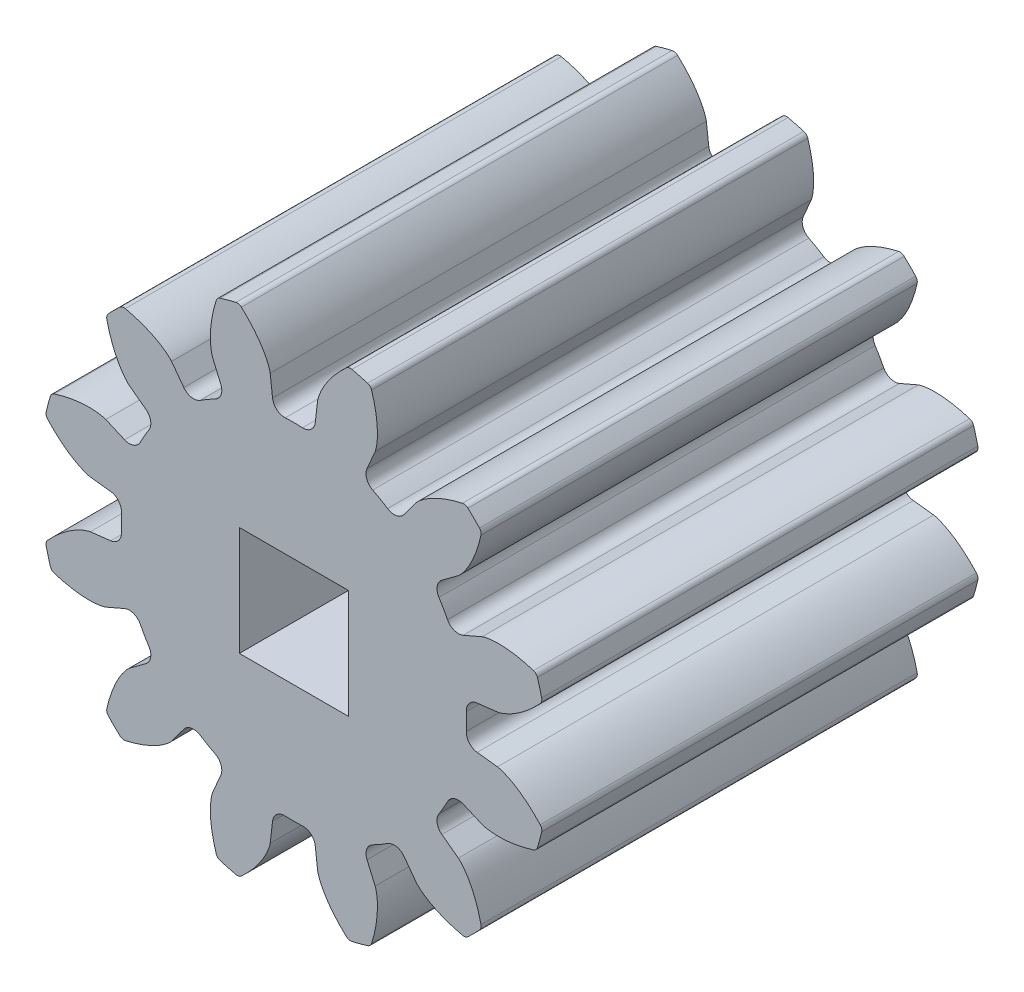
from build123d import *

# Parameters (mm, degrees)
SKETCH1_R                                 = 7.408333333
BOSS_EXTRUDE1_DEPTH                       = 12.7
CUT_EXTRUDE_DCLTBC_DEPTH                  = 17.463802889
FILLET_TIP_DCLTBC_R                       = 0.177538081
FILLET_ROOT_DCLTBC_R                      = 0.355076163
CIRPATTERN_DCLTBC_COUNT                   = 12
FILLET_TIP_DCLTBC_OF_CIRPATTERN_DCLTBC_R  = 0.177538081
FILLET_ROOT_DCLTBC_OF_CIRPATTERN_DCLTBC_R = 0.355076163
SKETCH4_W                                 = 3.175
SKETCH4_H                                 = 3.175
CUT_EXTRUDE2_DEPTH                        = 17.293789538


with BuildPart() as part:
    # Sketch1 → Boss-Extrude1 (new body)
    with BuildSketch(Plane.XY):
        Circle(SKETCH1_R)
    extrude(amount=BOSS_EXTRUDE1_DEPTH)

    # DCLTBC → Cut-Extrude-DCLTBC (cut, through all)
    with BuildSketch(Plane.XY):
        with BuildLine():
            Line((-0.690598508, 5.926950078), (-0.581811335, 4.993301754))
            ThreePointArc((-0.581811335, 4.993301754), (0, 5.027083333), (0.581811335, 4.993301754))
            Line((0.581811335, 4.993301754), (0.690598508, 5.926950078))
            add(Edge.make_bspline(
                [(0.690598508, 5.926950078), (0.690911872, 5.929318191), (0.691904892, 5.935944647), (0.694232443, 5.948407954), (0.69866684, 5.96863478), (0.70524939, 5.994230847), (0.714822349, 6.027084964), (0.727462413, 6.065467787), (0.74277265, 6.107282331), (0.760950457, 6.152345854), (0.780422108, 6.196898763), (0.801081108, 6.240942495), (0.822769247, 6.284441008), (0.8503395, 6.336662498), (0.885198626, 6.398612769), (0.92853373, 6.469984516), (0.980716028, 6.54965538), (1.037091207, 6.629400976), (1.095172788, 6.706647925), (1.156800213, 6.78320647), (1.218511327, 6.856219389), (1.285554849, 6.930432721), (1.348944008, 6.998115798), (1.423150182, 7.07205666), (1.483972917, 7.131183599), (1.549410219, 7.190627906), (1.581641114, 7.219315962), (1.598273068, 7.233873511)],
                knots=[0, 0, 0, 0, 0, 0.005376749, 0.015083688, 0.02853182, 0.046610139, 0.064854849, 0.092110525, 0.119476176, 0.146842496, 0.174208854, 0.201574956, 0.228941013, 0.256307345, 0.307035032, 0.361767352, 0.416499661, 0.471231937, 0.525964282, 0.580696615, 0.635428982, 0.690161387, 0.744893688, 0.799626082, 0.854358408, 0.909090915, 0.909090915, 0.909090915, 0.909090915, 0.909090915], degree=4))
            ThreePointArc((1.598273068, 7.233873511), (0, 7.408333333), (-1.598273068, 7.233873511))
            add(Edge.make_bspline(
                [(-0.690598508, 5.926950078), (-0.690911872, 5.929318191), (-0.691904892, 5.935944647), (-0.694232443, 5.948407954), (-0.69866684, 5.96863478), (-0.70524939, 5.994230847), (-0.714822349, 6.027084964), (-0.727462413, 6.065467787), (-0.74277265, 6.107282331), (-0.760950457, 6.152345854), (-0.780422108, 6.196898763), (-0.801081108, 6.240942495), (-0.822769247, 6.284441008), (-0.8503395, 6.336662498), (-0.885198626, 6.398612769), (-0.92853373, 6.469984516), (-0.980716028, 6.54965538), (-1.037091207, 6.629400976), (-1.095172788, 6.706647925), (-1.156800213, 6.78320647), (-1.218511327, 6.856219389), (-1.285554849, 6.930432721), (-1.348944008, 6.998115798), (-1.423150182, 7.07205666), (-1.483972917, 7.131183599), (-1.549410219, 7.190627906), (-1.581641114, 7.219315962), (-1.598273068, 7.233873511)],
                knots=[0, 0, 0, 0, 0, 0.005376749, 0.015083688, 0.02853182, 0.046610139, 0.064854849, 0.092110525, 0.119476176, 0.146842496, 0.174208854, 0.201574956, 0.228941013, 0.256307345, 0.307035032, 0.361767352, 0.416499661, 0.471231937, 0.525964282, 0.580696615, 0.635428982, 0.690161387, 0.744893688, 0.799626082, 0.854358408, 0.909090915, 0.909090915, 0.909090915, 0.909090915, 0.909090915], degree=4))
        make_face()
    cut_extrude_dcltbc = extrude(amount=CUT_EXTRUDE_DCLTBC_DEPTH, mode=Mode.SUBTRACT)

    # Fillet-Tip-DCLTBC
    fillet_tip_dcltbc_edges = [part.edges().sort_by_distance(p)[0] for p in [
        (1.598273068, 7.233873511, 6.35),
        (-1.598273068, 7.233873511, 6.35),
    ]]
    fillet(fillet_tip_dcltbc_edges, radius=FILLET_TIP_DCLTBC_R)

    # Fillet-Root-DCLTBC
    fillet_root_dcltbc_edges = [part.edges().sort_by_distance(p)[0] for p in [
        (-0.581811335, 4.993301754, 6.35),
        (0.581811335, 4.993301754, 6.35),
    ]]
    fillet(fillet_root_dcltbc_edges, radius=FILLET_ROOT_DCLTBC_R)

    # CirPattern-DCLTBC: Cut-Extrude-DCLTBC ×12 about axis
    cirpattern_dcltbc_axis = Axis((0, 0, 12.7), (0, 0, 1))
    for i in range(1, CIRPATTERN_DCLTBC_COUNT):
        add(cut_extrude_dcltbc.rotate(cirpattern_dcltbc_axis, i * 360 / CIRPATTERN_DCLTBC_COUNT), mode=Mode.SUBTRACT)

    # Fillet-Tip-DCLTBC of CirPattern-DCLTBC
    fillet_tip_dcltbc_of_cirpattern_dcltbc_edges = [part.edges().sort_by_distance(p)[0] for p in [
        (-2.232791676, 7.063854763, 6.35),
        (-5.001081835, 5.465581694, 6.35),
        (-5.465581694, 5.001081835, 6.35),
        (-7.063854763, 2.232791676, 6.35),
        (-7.233873511, 1.598273068, 6.35),
        (-7.233873511, -1.598273068, 6.35),
        (-7.063854763, -2.232791676, 6.35),
        (-5.465581694, -5.001081835, 6.35),
        (-5.001081835, -5.465581694, 6.35),
        (-2.232791676, -7.063854763, 6.35),
        (-1.598273068, -7.233873511, 6.35),
        (1.598273068, -7.233873511, 6.35),
        (2.232791676, -7.063854763, 6.35),
        (5.001081835, -5.465581694, 6.35),
        (5.465581694, -5.001081835, 6.35),
        (7.063854763, -2.232791676, 6.35),
        (7.233873511, -1.598273068, 6.35),
        (7.233873511, 1.598273068, 6.35),
        (7.063854763, 2.232791676, 6.35),
        (5.465581694, 5.001081835, 6.35),
        (5.001081835, 5.465581694, 6.35),
        (2.232791676, 7.063854763, 6.35),
    ]]
    fillet(fillet_tip_dcltbc_of_cirpattern_dcltbc_edges, radius=FILLET_TIP_DCLTBC_OF_CIRPATTERN_DCLTBC_R)

    # Fillet-Root-DCLTBC of CirPattern-DCLTBC
    fillet_root_dcltbc_of_cirpattern_dcltbc_edges = [part.edges().sort_by_distance(p)[0] for p in [
        (-3.000514274, 4.0334205, 6.35),
        (-1.99278748, 4.615231836, 6.35),
        (-4.615231836, 1.99278748, 6.35),
        (-4.0334205, 3.000514274, 6.35),
        (-4.993301754, -0.581811335, 6.35),
        (-4.993301754, 0.581811335, 6.35),
        (-4.0334205, -3.000514274, 6.35),
        (-4.615231836, -1.99278748, 6.35),
        (-1.99278748, -4.615231836, 6.35),
        (-3.000514274, -4.0334205, 6.35),
        (0.581811335, -4.993301754, 6.35),
        (-0.581811335, -4.993301754, 6.35),
        (3.000514274, -4.0334205, 6.35),
        (1.99278748, -4.615231836, 6.35),
        (4.615231836, -1.99278748, 6.35),
        (4.0334205, -3.000514274, 6.35),
        (4.993301754, 0.581811335, 6.35),
        (4.993301754, -0.581811335, 6.35),
        (4.0334205, 3.000514274, 6.35),
        (4.615231836, 1.99278748, 6.35),
        (1.99278748, 4.615231836, 6.35),
        (3.000514274, 4.0334205, 6.35),
    ]]
    fillet(fillet_root_dcltbc_of_cirpattern_dcltbc_edges, radius=FILLET_ROOT_DCLTBC_OF_CIRPATTERN_DCLTBC_R)

    # Sketch4 → Cut-Extrude2 (cut, through all)
    with BuildSketch(Plane.XY.offset(12.7)):
        Rectangle(SKETCH4_W, SKETCH4_H)
    extrude(amount=-CUT_EXTRUDE2_DEPTH, mode=Mode.SUBTRACT)


solid = part.part
